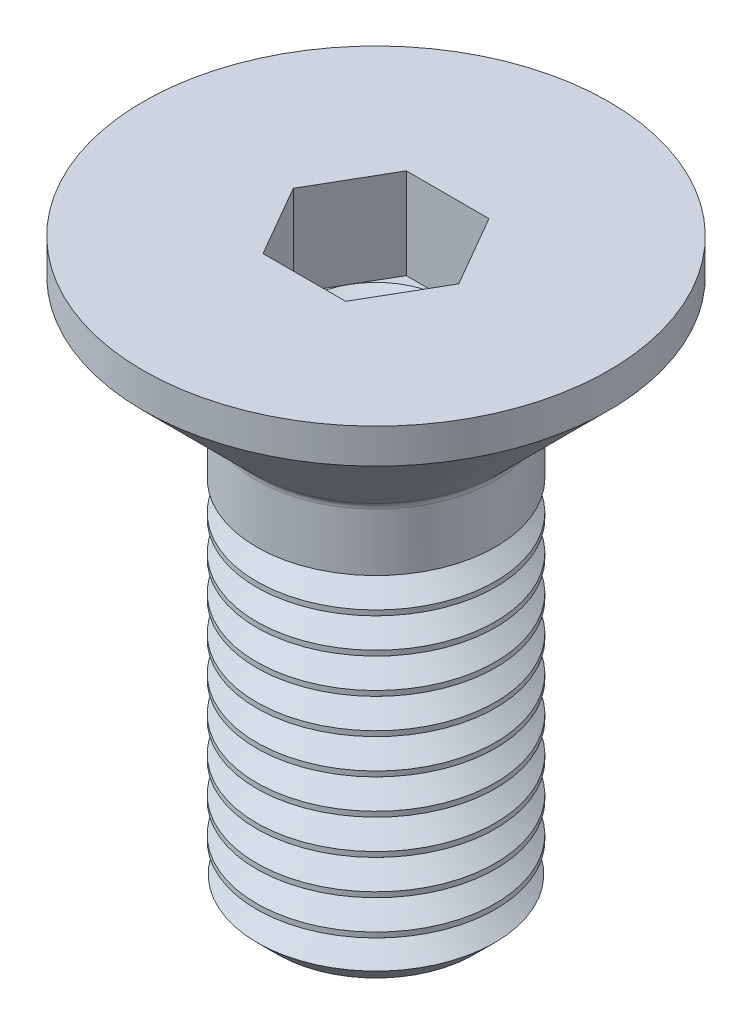
from build123d import *

# Parameters (mm, degrees)
FILLET1_R             = 0.2
HEX_START             = -1.9
HEX_2_DEPTH           = 1.9
THDSCHPAT_COUNT       = 10
THDSCHPAT_PITCH       = 0.73
BODY_MOVE_COPY1_ANGLE = 90


with BuildPart() as part:
    # BodySke → BaseBody (revolve)
    with BuildSketch(Plane.XY, mode=Mode.PRIVATE) as basebody_sk:
        Polygon((0, 0), (0, 4.875), (0.725, 4.875), (3.1, 2.5), (11.555, 2.5), (12, 2.055), (12, 0), align=None)
    revolve(basebody_sk.sketch.rotate(Axis((0, 0, 0), (1, 0, 0)), 90), axis=Axis((0, 0, 0), (1, 0, 0)))

    # Fillet1
    fillet1_edges = [part.edges().sort_by_distance(p)[0] for p in [
        (3.1, 0, -2.5),
    ]]
    fillet(fillet1_edges, radius=FILLET1_R)

    # Hex 2: read off the stored shape, not the designer's step
    # Hex 2 outline → Hex 2 (cut)
    with BuildSketch(Plane.ZY.offset(HEX_START)):
        Polygon((-1.5, -0.866025404), (0, -1.732050808), (1.5, -0.866025404), (1.5, 0.866025404), (0, 1.732050808), (-1.5, 0.866025404), align=None)
    extrude(amount=HEX_2_DEPTH, mode=Mode.SUBTRACT)

    # Hex 2 2 outline → Hex 2 2 (revolve, cut)
    with BuildSketch(Plane.YX):
        Polygon((1.5, 1.9), (0, 2.766025404), (0, 1.9), align=None)
    revolve(axis=Axis((0, 0, 0), (1, 0, 0)), mode=Mode.SUBTRACT)

    # ThdSchSke → ThreadSchematic (revolve, cut)
    with BuildSketch(Plane.XY, mode=Mode.PRIVATE) as threadschematic_sk:
        Polygon((4.700001, -2.055), (4.388408645, -2.5), (4.388408645, -3.125), (5.011593355, -3.125), (5.011593355, -2.5), align=None)
    threadschematic = revolve(threadschematic_sk.sketch.rotate(Axis((-3.175, 0, 0), (1, 0, 0)), 270), axis=Axis((-3.175, 0, 0), (1, 0, 0)), mode=Mode.SUBTRACT)

    # ThdSchPat: ThreadSchematic ×10
    with Locations(*[(i * THDSCHPAT_PITCH, 0, 0) for i in range(1, THDSCHPAT_COUNT)]):
        add(threadschematic, mode=Mode.SUBTRACT)


with BuildPart() as part_1:
    # Body-Move/Copy1: moved
    add(part.part.rotate(Axis((6, 0, 0), (0, 0, -1)), BODY_MOVE_COPY1_ANGLE))


solid = part_1.part
